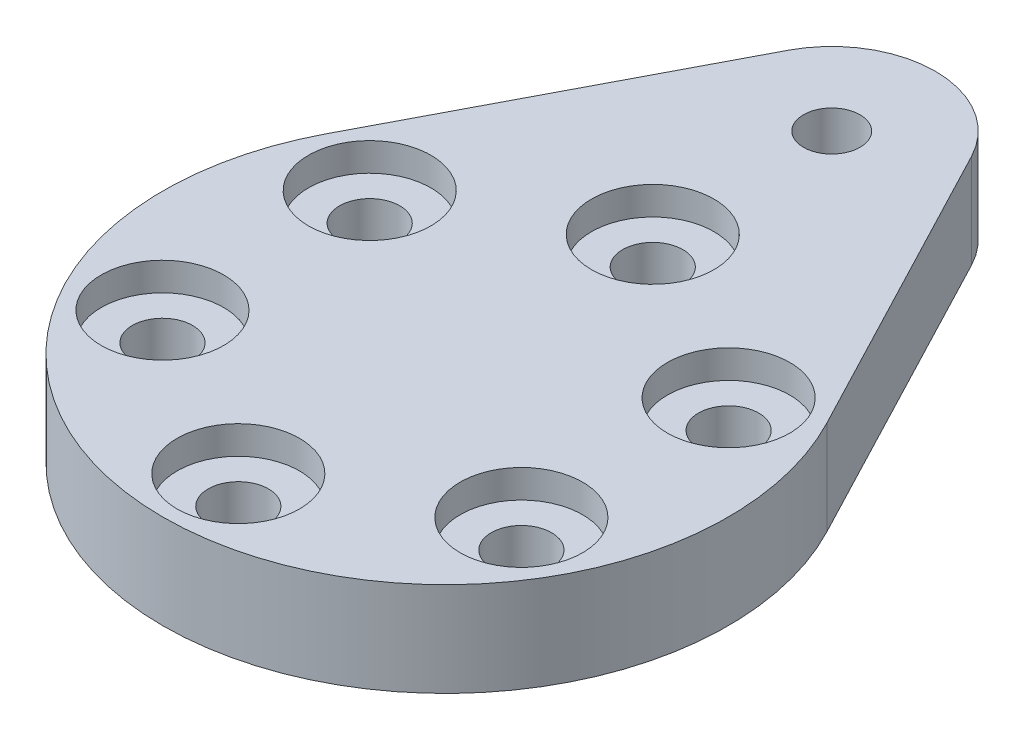
from build123d import *

# Parameters (mm, degrees)
SKETCH4_R           = 1.5
SKETCH4_R_2         = 1.6
BOSS_EXTRUDE1_DEPTH = 5
SKETCH6_R           = 3.25
CUT_EXTRUDE1_DEPTH  = 1.5


with BuildPart() as part:
    # Sketch4 → Boss-Extrude1 (new body)
    with BuildSketch(Plane(origin=(0, 0, 0), x_dir=(1, 0, 0), z_dir=(0, 1, 0))):
        with BuildLine():
            Line((-4.873778619, 23.048780488), (-13.292123506, 6.951219512))
            ThreePointArc((-13.292123506, 6.951219512), (0, -15), (13.292123506, 6.951219512))
            Line((13.292123506, 6.951219512), (4.873778619, 23.048780488))
            ThreePointArc((4.873778619, 23.048780488), (0, 26), (-4.873778619, 23.048780488))
        make_face()
        with Locations((0, 20.5)):
            Circle(SKETCH4_R, mode=Mode.SUBTRACT)
        with Locations((9.526279442, 5.5)):
            Circle(SKETCH4_R_2, mode=Mode.SUBTRACT)
        with Locations((-9.526279442, -5.5)):
            Circle(SKETCH4_R_2, mode=Mode.SUBTRACT)
        with Locations((-9.526279442, 5.5)):
            Circle(SKETCH4_R_2, mode=Mode.SUBTRACT)
        with Locations((0, -11)):
            Circle(SKETCH4_R_2, mode=Mode.SUBTRACT)
        with Locations((9.526279442, -5.5)):
            Circle(SKETCH4_R_2, mode=Mode.SUBTRACT)
        with Locations((0, 11)):
            Circle(SKETCH4_R_2, mode=Mode.SUBTRACT)
    extrude(amount=BOSS_EXTRUDE1_DEPTH)

    # Sketch6 → Cut-Extrude1 (cut)
    with BuildSketch(Plane(origin=(0, 5, 0), x_dir=(1, 0, 0), z_dir=(0, 1, 0))):
        with Locations((0, 11)):
            Circle(SKETCH6_R)
        with Locations((9.526279442, 5.5)):
            Circle(SKETCH6_R)
        with Locations((9.526279442, -5.5)):
            Circle(SKETCH6_R)
        with Locations((0, -11)):
            Circle(SKETCH6_R)
        with Locations((-9.526279442, -5.5)):
            Circle(SKETCH6_R)
        with Locations((-9.526279442, 5.5)):
            Circle(SKETCH6_R)
    extrude(amount=-CUT_EXTRUDE1_DEPTH, mode=Mode.SUBTRACT)


solid = part.part
